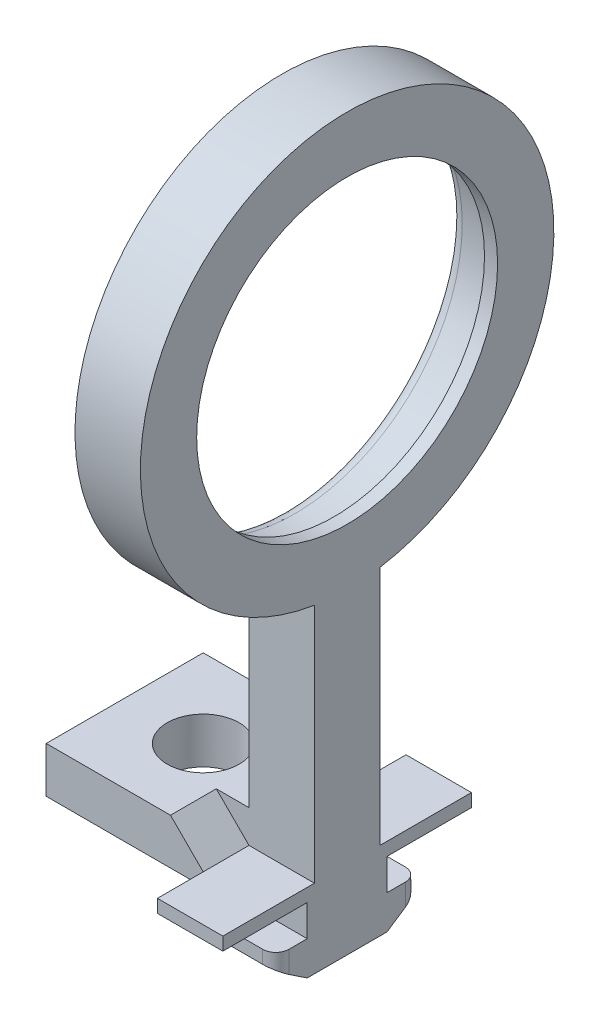
from build123d import *

# Parameters (mm, degrees)
SKETCH1_R            = 15.8
SKETCH1_R_2          = 12.8
BOSS_EXTRUDE1_DEPTH  = 5
SKETCH2_W            = 5
SKETCH2_H            = 19.399038491
BOSS_EXTRUDE2_DEPTH  = 5
BOSS_EXTRUDE3_DEPTH  = 5
FILLET1_R            = 1
SKETCH38_W           = 12
SKETCH38_H           = 3.5
BOSS_EXTRUDE28_DEPTH = 12
CUT_EXTRUDE3_REACH   = 54.687
SKETCH39_R           = 2.75
CHAMFER1_SIZE        = 2.5
FILLET3_R            = 1
SKETCH1_3_R          = 12.8
SKETCH1_3_R_2        = 11.5
BOSS_EXTRUDE29_DEPTH = 1


with BuildPart() as part:
    # Sketch1 → Boss-Extrude1 (new body)
    with BuildSketch(Plane(origin=(0, 0, 0), x_dir=(0, 0, -1), z_dir=(1, 0, 0))):
        Circle(SKETCH1_R)
        Circle(SKETCH1_R_2, mode=Mode.SUBTRACT)
    extrude(amount=-BOSS_EXTRUDE1_DEPTH)

    # Sketch2 → Boss-Extrude2 (add)
    with BuildSketch(Plane(origin=(0, 0, 0), x_dir=(0, 0, -1), z_dir=(1, 0, 0))):
        with Locations((0, -25.300480755)):
            Rectangle(SKETCH2_W, SKETCH2_H)
    extrude(amount=-BOSS_EXTRUDE2_DEPTH)

    # Sketch3 → Boss-Extrude3 (add)
    with BuildSketch(Plane(origin=(0, 0, 0), x_dir=(0, 0, -1), z_dir=(1, 0, 0))):
        Polygon((-9.5, -35), (-9.5, -34), (9.5, -34), (9.5, -35), (3.05, -35), (3.05, -37.4), (5.45, -37.4), (5.45, -38.4), (3.05, -40), (-3.05, -40), (-5.45, -38.4), (-5.45, -37.4), (-3.05, -37.4), (-3.05, -35), align=None)
    extrude(amount=-BOSS_EXTRUDE3_DEPTH)

    # Fillet1
    fillet1_edges = [part.edges().sort_by_distance(p)[0] for p in [
        (0, -37.9, 5.45),
        (0, -37.9, -5.45),
    ]]
    fillet(fillet1_edges, radius=FILLET1_R)

    # Sketch38 → Boss-Extrude28 (add)
    with BuildSketch(Plane.ZY.offset(5)):
        with Locations((0, -33.25)):
            Rectangle(SKETCH38_W, SKETCH38_H)
    extrude(amount=BOSS_EXTRUDE28_DEPTH)

    # Sketch39 → Cut-Extrude3 (cut, up to next)
    with BuildSketch(Plane(origin=(0, -31.5, 0), x_dir=(1, 0, 0), z_dir=(0, 1, 0)), mode=Mode.PRIVATE) as cut_extrude3_sk1:
        with Locations(Location((-11, 0, 0), (0, 0, 270))):
            Circle(SKETCH39_R)
    cut_extrude3_tool1 = extrude(cut_extrude3_sk1.sketch, amount=-CUT_EXTRUDE3_REACH, mode=Mode.PRIVATE) & part.part
    add(cut_extrude3_tool1.solids().sort_by_distance((-11, -31.5, 0))[0], mode=Mode.SUBTRACT)

    # Chamfer1
    chamfer1_edges = [part.edges().sort_by_distance(p)[0] for p in [
        (-5, -31.5, 4.25),
        (-5, -31.5, -4.25),
    ]]
    chamfer(chamfer1_edges, length=CHAMFER1_SIZE - 0.0001)  # a hair under: the kernel refuses the full size

    # Fillet3
    fillet3_edges = [part.edges().sort_by_distance(p)[0] for p in [
        (-5, 0, 12.8),
    ]]
    fillet(fillet3_edges, radius=FILLET3_R)

    # Sketch1<3> → Boss-Extrude29 (add)
    with BuildSketch(Plane(origin=(0, 0, 0), x_dir=(0, 0, -1), z_dir=(1, 0, 0))):
        Circle(SKETCH1_3_R)
        Circle(SKETCH1_3_R_2, mode=Mode.SUBTRACT)
    extrude(amount=-BOSS_EXTRUDE29_DEPTH)


solid = part.part
